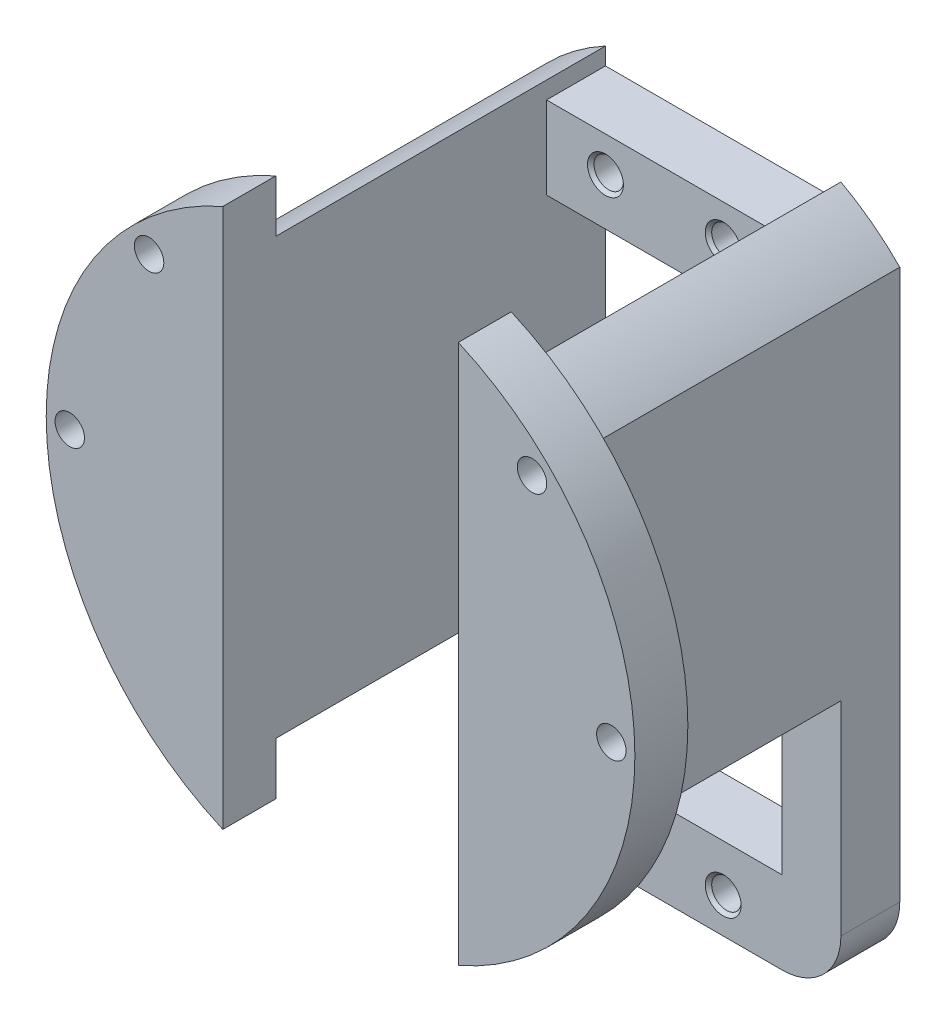
from build123d import *
from build123d.topology import SkipClean

# Parameters (mm, degrees)
SKETCH_1_W                  = 30
SKETCH_1_H                  = 54
SKETCH_1_W_2                = 20
SKETCH_1_H_2                = 40
EXTRUDE_1_DEPTH             = 5
EXTRUDE_2_DEPTH             = 28
SKETCH_3_OUTSIDE_W          = 45.8
SKETCH_3_OUTSIDE_H          = 71.266
CUT_EXTRUDE_1_DEPTH         = 49.764741361
FILLET_1_R                  = 5
EXTRUDE_3_DEPTH             = 4.5
M3X0_51_D                   = 2.5
M3X0_51_CSINK_D             = 3.05
M3X0_51_CSINK_ANGLE         = 90
PATTERN_LINEAR_1_COUNT      = 2
PATTERN_LINEAR_1_PITCH      = 10
PATTERN_LINEAR_1_COUNT_DIR2 = 2
PATTERN_LINEAR_1_PITCH_DIR2 = 48
HOLE_WIZARD_1_D             = 2.5
PATTERN_CIRCULAR_1_COUNT    = 8


with BuildPart() as part:
    # Эскиз1 → Бобышка-Вытянуть1 (new body)
    with BuildSketch(Plane.XY):
        with Locations((0, -10)):
            Rectangle(SKETCH_1_W, SKETCH_1_H)
        with Locations((0, -10)):
            Rectangle(SKETCH_1_W_2, SKETCH_1_H_2, mode=Mode.SUBTRACT)
    extrude(amount=EXTRUDE_1_DEPTH)

    # Эскиз2 → Бобышка-Вытянуть2 (add)
    with BuildSketch(Plane.XY):
        with BuildLine():
            Line((10, -18.466185313), (10, 18.466185313))
            ThreePointArc((10, 18.466185313), (12.641273886, 16.76896522), (15, 14.696938457))
            Line((15, 14.696938457), (15, -14.696938457))
            ThreePointArc((15, -14.696938457), (12.641273886, -16.76896522), (10, -18.466185313))
        make_face()
        with BuildLine():
            Line((-10, -18.466185313), (-10, 18.466185313))
            ThreePointArc((-10, 18.466185313), (-12.641273886, 16.76896522), (-15, 14.696938457))
            Line((-15, 14.696938457), (-15, -14.696938457))
            ThreePointArc((-15, -14.696938457), (-12.641273886, -16.76896522), (-10, -18.466185313))
        make_face()
    extrude(amount=EXTRUDE_2_DEPTH)

    # Эскиз3 outside → Вырез-Вытянуть1 (cut, through all)
    with SkipClean():  # the faces are left unmerged after this step: merging them gives an invalid solid
        with BuildSketch(Plane.XY.offset(28)):
            with Locations((0, -9.267)):
                Rectangle(SKETCH_3_OUTSIDE_W, SKETCH_3_OUTSIDE_H)
            with BuildLine():
                Line((-15, -14.696938457), (-15, -37))
                Line((-15, -37), (15, -37))
                Line((15, -37), (15, -14.696938457))
                ThreePointArc((15, -14.696938457), (0, 21), (-15, -14.696938457))
            make_face(mode=Mode.SUBTRACT)
        extrude(amount=-CUT_EXTRUDE_1_DEPTH, mode=Mode.SUBTRACT)

    # Скругление1
    fillet_1_edges = [part.edges().sort_by_distance(p)[0] for p in [
        (-15, -37, 2.5),
        (15, -37, 2.5),
    ]]
    fillet(fillet_1_edges, radius=FILLET_1_R)

    # Эскиз7 → Бобышка-Вытянуть3 (add)
    with BuildSketch(Plane.XY.offset(28)):
        with BuildLine():
            Line((-10, -22.912878475), (-10, 22.912878475))
            ThreePointArc((-10, 22.912878475), (-25, 0), (-10, -22.912878475))
        make_face()
        with BuildLine():
            Line((10, -22.912878475), (10, 22.912878475))
            ThreePointArc((10, 22.912878475), (25, 0), (10, -22.912878475))
        make_face()
    extrude(amount=EXTRUDE_3_DEPTH)

    # Отверстие обработанное метчиком M3x0.51 (through all)
    with Locations(Plane.XY.offset(5)):
        with Locations((-5, 14)):
            m3x0_51 = CounterSinkHole(M3X0_51_D / 2, M3X0_51_CSINK_D / 2, counter_sink_angle=M3X0_51_CSINK_ANGLE)

    # Линейный массив1: M3x0.51 2 × 2
    with Locations(*[(i * PATTERN_LINEAR_1_PITCH, -j * PATTERN_LINEAR_1_PITCH_DIR2, 0) for i in range(PATTERN_LINEAR_1_COUNT) for j in range(PATTERN_LINEAR_1_COUNT_DIR2) if (i, j) != (0, 0)]):
        add(m3x0_51, mode=Mode.SUBTRACT)

    # Отверстие1 (through all)
    with Locations(Plane.XY.offset(32.5)):
        with Locations((-23, 0)):
            hole_wizard_1 = Hole(HOLE_WIZARD_1_D / 2)

    # Круговой массив1: Отверстие1 ×8 about axis, 4 skipped
    pattern_circular_1_axis = Axis((0, 0, 32.5), (0, 0, 1))
    add([hole_wizard_1.rotate(pattern_circular_1_axis, i * 360 / PATTERN_CIRCULAR_1_COUNT) for i in range(1, PATTERN_CIRCULAR_1_COUNT) if i not in (1, 2, 3, 6)], mode=Mode.SUBTRACT)


solid = part.part
